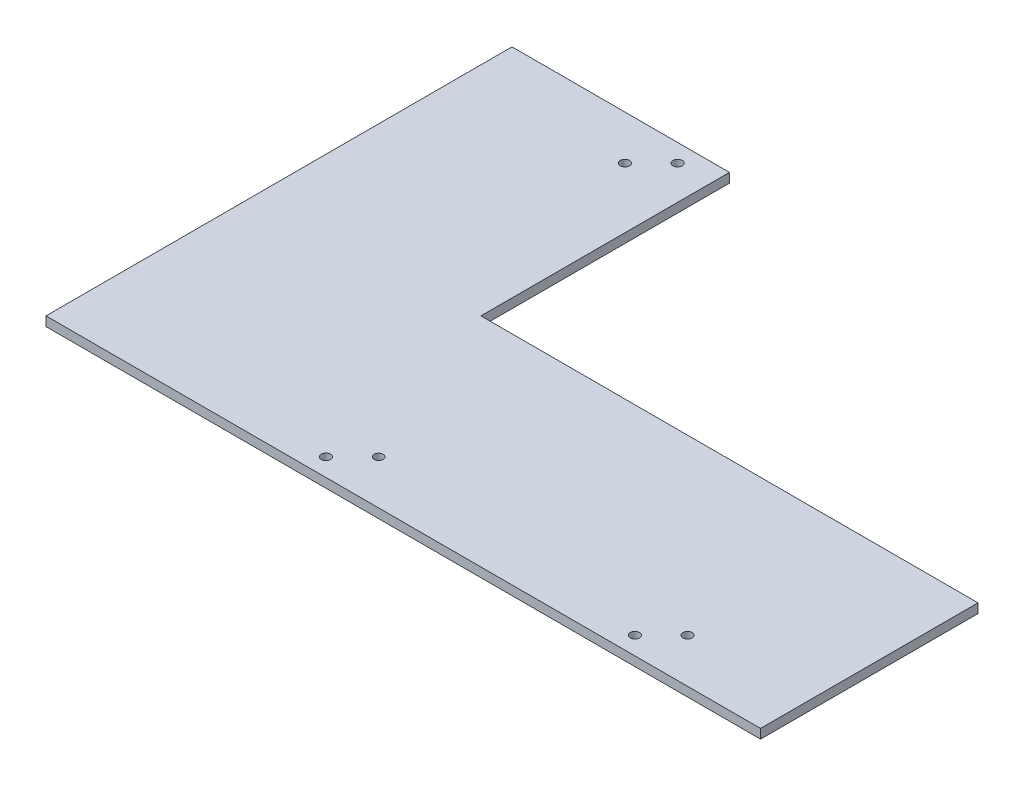
from build123d import *

# Parameters (mm, degrees)
SKETCH1_R           = 1.5
SKETCH1_R_2         = 1.44463942
BOSS_EXTRUDE1_DEPTH = 3


with BuildPart() as part:
    # Sketch1 → Boss-Extrude1 (new body)
    with BuildSketch(Plane(origin=(0, 0, 0), x_dir=(1, 0, 0), z_dir=(0, 1, 0))):
        Polygon((-115, -35), (115, -35), (115, 35), (-45, 35), (-45, 115), (-115, 115), (-115, 35), align=None)
        with Locations((-30.653242174, -29.242640687)):
            Circle(SKETCH1_R, mode=Mode.SUBTRACT)
        with Locations((-22.1679608, -20.757359313)):
            Circle(SKETCH1_R_2, mode=Mode.SUBTRACT)
        with Locations((68.794933526, -29.242640687)):
            Circle(SKETCH1_R, mode=Mode.SUBTRACT)
        with Locations((77.2802149, -20.757359313)):
            Circle(SKETCH1_R, mode=Mode.SUBTRACT)
        with Locations((-64.410432826, 100.757359313)):
            Circle(SKETCH1_R, mode=Mode.SUBTRACT)
        with Locations((-55.925151452, 109.242640687)):
            Circle(SKETCH1_R, mode=Mode.SUBTRACT)
    extrude(amount=BOSS_EXTRUDE1_DEPTH)


solid = part.part
